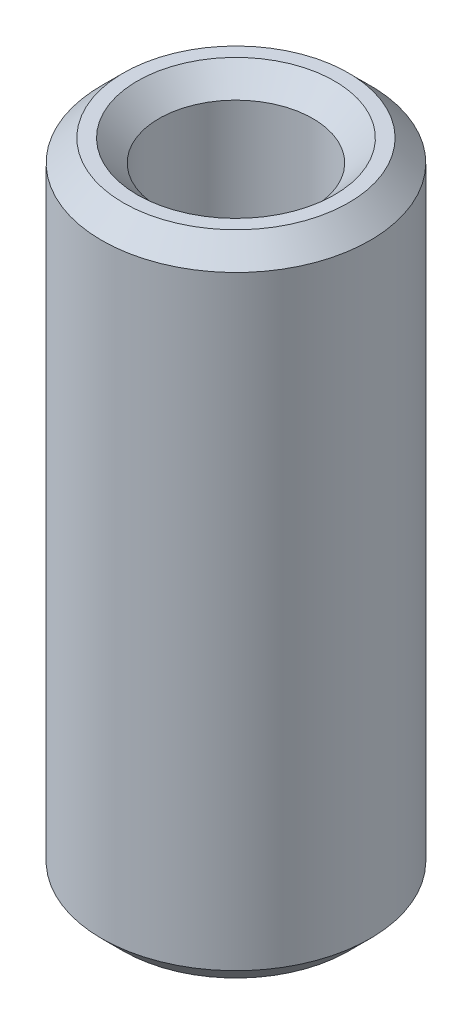
from build123d import *

# Parameters (mm, degrees)
SKETCH1_R           = 7.5
BOSS_EXTRUDE1_DEPTH = 36.206883899
SKETCH2_R           = 4.299113173
CUT_EXTRUDE1_DEPTH  = 38.728483161
CHAMFER1_SIZE       = 1.210647009


with BuildPart() as part:
    # Sketch1 → Boss-Extrude1 (new body)
    with BuildSketch(Plane(origin=(0, 0, 0), x_dir=(1, 0, 0), z_dir=(0, 1, 0))):
        Circle(SKETCH1_R)
    extrude(amount=BOSS_EXTRUDE1_DEPTH)

    # Sketch2 → Cut-Extrude1 (cut, through all)
    with BuildSketch(Plane(origin=(0, 0, 0), x_dir=(1, 0, 0), z_dir=(0, 1, 0))):
        Circle(SKETCH2_R)
    extrude(amount=CUT_EXTRUDE1_DEPTH, mode=Mode.SUBTRACT)

    # Chamfer1
    chamfer1_edges = [part.edges().sort_by_distance(p)[0] for p in [
        (-4.299113173, 36.206883899, 0),
        (-4.299113173, 0, 0),
        (-7.5, 0, 0),
        (-7.5, 36.206883899, 0),
    ]]
    chamfer(chamfer1_edges, length=CHAMFER1_SIZE)


solid = part.part
